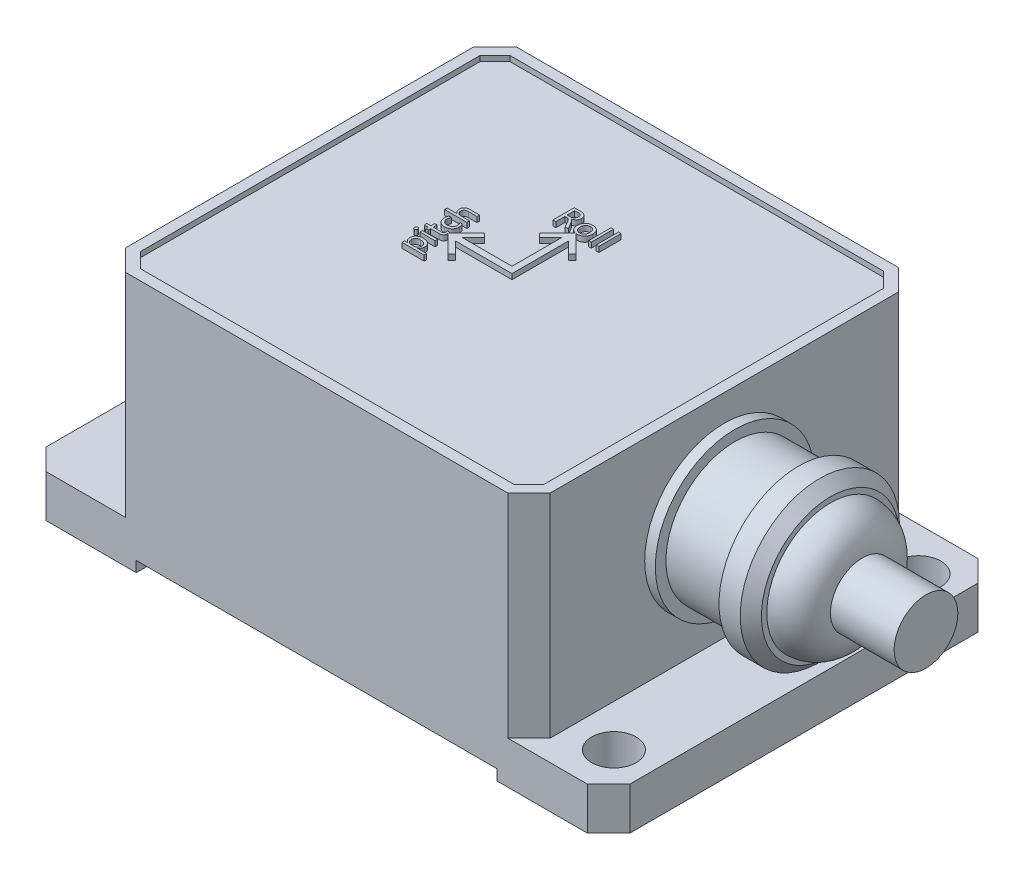
from build123d import *

# Parameters (mm, degrees)
SKETCH_1_W          = 55
SKETCH_1_H          = 36.8
EXTRUDE_1_DEPTH     = 4
SKETCH_2_W          = 40
SKETCH_2_H          = 36.8
EXTRUDE_2_DEPTH     = 20
CHAMFER_1_SIZE      = 2
SKETCH_3_R          = 2.1
CUT_EXTRUDE_1_DEPTH = 20
SKETCH_4_W          = 34
SKETCH_4_H          = 2
CUT_EXTRUDE_2_DEPTH = 52.831361163
CUT_EXTRUDE_3_DEPTH = 0.5
EXTRUDE_3_DEPTH     = 0.5
SKETCH_7_W          = 1.414634147
SKETCH_7_H          = 0.243902439
SKETCH_7_W_2        = 0.243902439
SKETCH_7_H_2        = 2.097560976
EXTRUDE_4_DEPTH     = 0.5
SKETCH_9_R          = 7.5
EXTRUDE_5_DEPTH     = 10
SKETCH_10_R         = 6
EXTRUDE_6_DEPTH     = 3
FILLET_1_R          = 3
SKETCH_11_R         = 3
EXTRUDE_7_DEPTH     = 6
CHAMFER_2_SIZE      = 1
SKETCH_12_R         = 7.5
SKETCH_12_R_2       = 6.5
CUT_EXTRUDE_4_DEPTH = 6


with BuildPart() as part:
    # 草图1 → 凸台-拉伸1 (new body)
    with BuildSketch(Plane(origin=(0, 0, 0), x_dir=(1, 0, 0), z_dir=(0, 1, 0))):
        Rectangle(SKETCH_1_W, SKETCH_1_H)
    extrude(amount=EXTRUDE_1_DEPTH)

    # 草图2 → 凸台-拉伸2 (add)
    with BuildSketch(Plane(origin=(0, 4, 0), x_dir=(1, 0, 0), z_dir=(0, 1, 0))):
        Rectangle(SKETCH_2_W, SKETCH_2_H)
    extrude(amount=EXTRUDE_2_DEPTH)

    # 倒角1
    chamfer_1_edges = [part.edges().sort_by_distance(p)[0] for p in [
        (20, 14, 18.4),
        (20, 14, -18.4),
        (-20, 14, -18.4),
        (-20, 14, 18.4),
        (27.5, 2, 18.4),
        (-27.5, 2, 18.4),
        (-27.5, 2, -18.4),
        (27.5, 2, -18.4),
    ]]
    chamfer(chamfer_1_edges, length=CHAMFER_1_SIZE)

    # 草图3 → 切除-拉伸1 (cut)
    with BuildSketch(Plane(origin=(0, 4, 0), x_dir=(1, 0, 0), z_dir=(0, 1, 0))):
        with Locations(Location((-23.95, 0, 0), (0, 0, 270))):
            Circle(SKETCH_3_R)
        with Locations(Location((23.95, -14.35, 0), (0, 0, 270))):
            Circle(SKETCH_3_R)
        with Locations(Location((23.95, 14.35, 0), (0, 0, 270))):
            Circle(SKETCH_3_R)
    extrude(amount=-CUT_EXTRUDE_1_DEPTH, mode=Mode.SUBTRACT)

    # 草图4 → 切除-拉伸2 (cut, through all)
    with BuildSketch(Plane.XY.offset(18.4)):
        Rectangle(SKETCH_4_W, SKETCH_4_H)
    extrude(amount=-CUT_EXTRUDE_2_DEPTH, mode=Mode.SUBTRACT)

    # 草图5 → 切除-拉伸3 (cut)
    with BuildSketch(Plane(origin=(0, 24, 0), x_dir=(1, 0, 0), z_dir=(0, 1, 0))):
        Polygon((17.585786438, 17.4), (-17.585786438, 17.4), (-19, 15.985786438), (-19, -15.985786438), (-17.585786438, -17.4), (17.585786438, -17.4), (19, -15.985786438), (19, 15.985786438), align=None)
    extrude(amount=-CUT_EXTRUDE_3_DEPTH, mode=Mode.SUBTRACT)

    # 草图6 → 凸台-拉伸3 (add)
    with BuildSketch(Plane(origin=(0, 23.5, 0), x_dir=(1, 0, 0), z_dir=(0, 1, 0))):
        Polygon((-0.3, 0.3), (-5, 0.3), (-3.939339828, 1.360660172), (-4.292893219, 1.714213562), (-6.007106781, 0), (-4.292893219, -1.714213562), (-3.939339828, -1.360660172), (-5, -0.3), (0, -0.3), (0.3, -0.3), (0.3, 0), (0.3, 5), (1.360660172, 3.939339828), (1.714213562, 4.292893219), (0, 6.007106781), (-1.714213562, 4.292893219), (-1.360660172, 3.939339828), (-0.3, 5), align=None)
    extrude(amount=EXTRUDE_3_DEPTH)

    # 草图7 → 凸台-拉伸4 (add)
    # profile 1 of 10: a face of its own
    with BuildSketch(Plane(origin=(0, 23.5, 0), x_dir=(1, 0, 0), z_dir=(0, 1, 0))):
        with BuildLine():
            Line((-6.228143367, -2.682926829), (-5.348570196, -2.682926829))
            Line((-5.348570196, -2.682926829), (-5.348570196, -2.926829268))
            Line((-5.348570196, -2.926829268), (-7.421740928, -2.926829268))
            Line((-7.421740928, -2.926829268), (-7.421740928, -2.682926829))
            Line((-7.421740928, -2.682926829), (-7.15573483, -2.682926829))
            Line((-7.15573483, -2.682926829), (-7.15573483, -2.677591463))
            add(Edge.make_bspline(
                [(-7.15573483, -2.677591463), (-7.178888789, -2.663185346), (-7.223877645, -2.635193816), (-7.282991276, -2.584420625), (-7.333608214, -2.529414433), (-7.374704079, -2.468847266), (-7.407272995, -2.403601095), (-7.429419275, -2.333077041), (-7.443755863, -2.257947748), (-7.445325223, -2.206115517), (-7.446131171, -2.179496951)],
                knots=[0, 0, 0, 0, 1.078187335, 2.094951195, 3.073951912, 4.029433151, 4.983033233, 5.949986131, 6.947210472, 8, 8, 8, 8], degree=3))
            add(Edge.make_bspline(
                [(-7.446131171, -2.179496951), (-7.445559746, -2.156853256), (-7.444447694, -2.112786284), (-7.435391667, -2.048599984), (-7.421200267, -1.988059142), (-7.400406288, -1.931360936), (-7.374108751, -1.878239046), (-7.341262434, -1.829221144), (-7.303146509, -1.783627855), (-7.258990824, -1.742353654), (-7.209822516, -1.705690981), (-7.156810093, -1.673029024), (-7.099503908, -1.645879702), (-7.038166076, -1.623910904), (-6.972970369, -1.606191029), (-6.903652731, -1.594449183), (-6.830596288, -1.586357206), (-6.780504438, -1.585701872), (-6.754820196, -1.585365854)],
                knots=[0, 0, 0, 0, 1.054889125, 2.052923234, 3.01501475, 3.947730946, 4.861176617, 5.770854059, 6.691104601, 7.62511638, 8.580664347, 9.545266383, 10.522431879, 11.530008075, 12.578381207, 13.666585891, 14.803558425, 16, 16, 16, 16], degree=3))
            add(Edge.make_bspline(
                [(-6.754820196, -1.585365854), (-6.72647123, -1.585828166), (-6.671040292, -1.586732128), (-6.589989501, -1.595250163), (-6.513310515, -1.609328583), (-6.440682685, -1.628489492), (-6.372816432, -1.654412876), (-6.308528626, -1.684674664), (-6.249039769, -1.721489785), (-6.194173466, -1.763380316), (-6.144444808, -1.809721524), (-6.101200589, -1.86069206), (-6.064389955, -1.915345678), (-6.034279104, -1.974037927), (-6.011081767, -2.036614658), (-5.994807234, -2.10311658), (-5.984630269, -2.173339903), (-5.983364876, -2.221509034), (-5.982716537, -2.246189024)],
                knots=[0, 0, 0, 0, 1.188216021, 2.323327435, 3.411778528, 4.454337825, 5.467243364, 6.453418599, 7.428937949, 8.393992373, 9.343461741, 10.272914612, 11.190188136, 12.100057099, 13.031932826, 13.981312572, 14.965703029, 16, 16, 16, 16], degree=3))
            add(Edge.make_bspline(
                [(-5.982716537, -2.246189024), (-5.983425332, -2.268847437), (-5.984812613, -2.313195408), (-5.99636245, -2.377734219), (-6.015992244, -2.438002001), (-6.04292316, -2.494548873), (-6.077902437, -2.546839075), (-6.120267337, -2.595405809), (-6.170658569, -2.639559971), (-6.208642376, -2.66468976), (-6.228143367, -2.677591463)],
                knots=[0, 0, 0, 0, 1.044186918, 2.043725318, 3.010571141, 3.958896111, 4.922187342, 5.901827956, 6.922792684, 8, 8, 8, 8], degree=3))
            Line((-6.228143367, -2.677591463), (-6.228143367, -2.682926829))
        make_face()
        with BuildLine():
            add(Edge.make_bspline(
                [(-6.595140318, -2.684070122), (-6.581529734, -2.683692888), (-6.554837207, -2.682953071), (-6.515663144, -2.677456577), (-6.478155189, -2.668684256), (-6.442135632, -2.656624422), (-6.408036113, -2.64034273), (-6.375494397, -2.620819919), (-6.344390236, -2.59781782), (-6.315374856, -2.571305693), (-6.288858793, -2.542290703), (-6.265703665, -2.510953052), (-6.245892255, -2.477968606), (-6.229776866, -2.443090591), (-6.217538285, -2.406509835), (-6.20881556, -2.368216236), (-6.203350226, -2.328027167), (-6.20260736, -2.300576522), (-6.202228732, -2.286585366)],
                knots=[0, 0, 0, 0, 1.046458427, 2.052271993, 3.035679634, 4.0057495, 4.967172194, 5.935568082, 6.920333484, 7.936953682, 8.953573879, 9.938339281, 10.928517117, 11.907645246, 12.886968303, 13.889407684, 14.924264675, 16, 16, 16, 16], degree=3))
            add(Edge.make_bspline(
                [(-6.202228732, -2.286585366), (-6.202633456, -2.270043533), (-6.203421701, -2.237826459), (-6.210573431, -2.190842188), (-6.221679162, -2.146455056), (-6.238342735, -2.105145628), (-6.259078719, -2.066375184), (-6.284722117, -2.030666788), (-6.314763214, -1.997392877), (-6.349573128, -1.967572905), (-6.388053713, -1.940313273), (-6.430574244, -1.91708758), (-6.476690649, -1.89781274), (-6.525894012, -1.881252274), (-6.578835596, -1.868717181), (-6.635313126, -1.860209996), (-6.695262661, -1.854753764), (-6.736388187, -1.854029913), (-6.757487879, -1.853658537)],
                knots=[0, 0, 0, 0, 0.997677617, 1.943089067, 2.86163638, 3.75280666, 4.624068763, 5.509018114, 6.399099569, 7.322942249, 8.269409922, 9.240398368, 10.239988683, 11.28243395, 12.370208899, 13.518437828, 14.726819993, 16, 16, 16, 16], degree=3))
            add(Edge.make_bspline(
                [(-6.757487879, -1.853658537), (-6.775288364, -1.853866247), (-6.810085804, -1.854272291), (-6.860746895, -1.859907296), (-6.90840096, -1.868114352), (-6.953262171, -1.879498736), (-6.994928962, -1.894725324), (-7.03384395, -1.913016938), (-7.069572323, -1.934949611), (-7.102198745, -1.960051253), (-7.131781344, -1.987739901), (-7.156988165, -2.018529881), (-7.178500564, -2.051479538), (-7.196209926, -2.086874883), (-7.20992242, -2.124874112), (-7.219833868, -2.165352203), (-7.225562581, -2.208295523), (-7.226261696, -2.237660705), (-7.226618976, -2.252667683)],
                knots=[0, 0, 0, 0, 1.226032639, 2.396720938, 3.507764523, 4.556614879, 5.581221338, 6.56012207, 7.51496907, 8.463939536, 9.392750702, 10.300617643, 11.198981417, 12.099390027, 13.021535839, 13.976944443, 14.966124265, 16, 16, 16, 16], degree=3))
            add(Edge.make_bspline(
                [(-7.226618976, -2.252667683), (-7.226299991, -2.268060525), (-7.225672568, -2.298337151), (-7.219336407, -2.342605677), (-7.209505023, -2.384736564), (-7.195756906, -2.424795255), (-7.177655324, -2.462637012), (-7.155916462, -2.498571943), (-7.130245736, -2.532434263), (-7.100401698, -2.563367865), (-7.068080074, -2.592021295), (-7.032598398, -2.616252269), (-6.995564212, -2.63776829), (-6.955650261, -2.65415503), (-6.913931865, -2.667779196), (-6.869868918, -2.677167503), (-6.823577374, -2.683039924), (-6.791931922, -2.683722), (-6.775780562, -2.684070122)],
                knots=[0, 0, 0, 0, 1.055142017, 2.075389376, 3.060199554, 4.019076789, 4.973907943, 5.93171582, 6.895370789, 7.881413521, 8.875621505, 9.852071251, 10.823610854, 11.807495604, 12.804943363, 13.830311844, 14.892623976, 16, 16, 16, 16], degree=3))
            Line((-6.775780562, -2.684070122), (-6.595140318, -2.684070122))
        make_face(mode=Mode.SUBTRACT)
    # profile 2 of 10: a face of its own
    with BuildSketch(Plane(origin=(0, 23.5, 0), x_dir=(1, 0, 0), z_dir=(0, 1, 0))):
        with BuildLine():
            add(Edge.make_bspline(
                [(-7.920597635, -1.268292683), (-7.931471537, -1.267895086), (-7.952713513, -1.267118387), (-7.982816768, -1.257653049), (-8.010738931, -1.243988353), (-8.03479701, -1.223963533), (-8.055035972, -1.20020657), (-8.069841896, -1.173132243), (-8.078507231, -1.1431766), (-8.079674897, -1.122389503), (-8.080277513, -1.111661585)],
                knots=[0, 0, 0, 0, 1.043030261, 2.037541102, 3.011077323, 4.019551348, 5.026392696, 6.000466463, 6.968069955, 8, 8, 8, 8], degree=3))
            add(Edge.make_bspline(
                [(-8.080277513, -1.111661585), (-8.079875386, -1.100790351), (-8.079089839, -1.079553586), (-8.069636682, -1.049248209), (-8.055619437, -1.021328966), (-8.035586643, -0.996909335), (-8.011279471, -0.976933988), (-7.983877788, -0.961385746), (-7.952949546, -0.953086601), (-7.931566392, -0.95185254), (-7.920597635, -0.951219512)],
                knots=[0, 0, 0, 0, 1.029888689, 2.011869274, 2.989384935, 3.985152777, 4.988579081, 5.96676578, 6.957027029, 8, 8, 8, 8], degree=3))
            add(Edge.make_bspline(
                [(-7.920597635, -0.951219512), (-7.90975352, -0.951850052), (-7.888615582, -0.953079135), (-7.858082406, -0.961413806), (-7.831054636, -0.976814176), (-7.807481224, -0.997174805), (-7.787489492, -1.021308294), (-7.773360005, -1.049187985), (-7.764512689, -1.079622734), (-7.763647815, -1.100801814), (-7.763204342, -1.111661585)],
                knots=[0, 0, 0, 0, 1.038223291, 2.023761268, 2.998208053, 3.990102717, 4.992895612, 5.97730756, 6.962845537, 8, 8, 8, 8], degree=3))
            add(Edge.make_bspline(
                [(-7.763204342, -1.111661585), (-7.763641333, -1.122521604), (-7.764488639, -1.143578673), (-7.773284345, -1.17367933), (-7.787525424, -1.200908814), (-7.807516127, -1.2242627), (-7.831084595, -1.24394461), (-7.858289438, -1.258312653), (-7.888572951, -1.266954285), (-7.909742666, -1.267839025), (-7.920597635, -1.268292683)],
                knots=[0, 0, 0, 0, 1.047673501, 2.031389945, 3.003999308, 3.99801593, 4.984183625, 5.956792988, 6.952326499, 8, 8, 8, 8], degree=3))
        make_face()
    # profile 3 of 10: a face of its own
    with BuildSketch(Plane(origin=(0, 23.5, 0), x_dir=(1, 0, 0), z_dir=(0, 1, 0))):
        with Locations((-6.714423854, -1.12195122)):
            Rectangle(SKETCH_7_W, SKETCH_7_H)
    # profile 4 of 10: a face of its own
    with BuildSketch(Plane(origin=(0, 23.5, 0), x_dir=(1, 0, 0), z_dir=(0, 1, 0))):
        with BuildLine():
            add(Edge.make_bspline(
                [(-6.037594586, 0.146341463), (-6.029031083, 0.13148125), (-6.011296475, 0.100706456), (-5.994760964, 0.047161362), (-5.984394212, -0.013052134), (-5.983294257, -0.055716675), (-5.982716537, -0.078125)],
                knots=[0, 0, 0, 0, 0.876635898, 1.815471108, 2.852638957, 4, 4, 4, 4], degree=3))
            add(Edge.make_bspline(
                [(-5.982716537, -0.078125), (-5.982953319, -0.09363924), (-5.983414598, -0.123862797), (-5.988593468, -0.167675015), (-5.99623602, -0.208601838), (-6.0079438, -0.246291737), (-6.022207768, -0.281230041), (-6.040307278, -0.31298453), (-6.061331823, -0.341946488), (-6.085934693, -0.367565645), (-6.113743135, -0.390255292), (-6.144576488, -0.410177034), (-6.179039035, -0.426470676), (-6.21632216, -0.440342301), (-6.257165174, -0.450367334), (-6.300950989, -0.458003464), (-6.348091607, -0.462610285), (-6.380571999, -0.463140656), (-6.397350684, -0.463414634)],
                knots=[0, 0, 0, 0, 1.146606007, 2.233722854, 3.257987083, 4.220703627, 5.147033956, 6.043005145, 6.91663835, 7.786982928, 8.661373291, 9.565530169, 10.494001205, 11.474697032, 12.502186621, 13.598637889, 14.759506997, 16, 16, 16, 16], degree=3))
            Line((-6.397350684, -0.463414634), (-7.202228732, -0.463414634))
            Line((-7.202228732, -0.463414634), (-7.202228732, -0.707317073))
            Line((-7.202228732, -0.707317073), (-7.421740928, -0.707317073))
            Line((-7.421740928, -0.707317073), (-7.421740928, -0.463414634))
            Line((-7.421740928, -0.463414634), (-7.757868976, -0.463414634))
            Line((-7.757868976, -0.463414634), (-7.836375074, -0.219512195))
            Line((-7.836375074, -0.219512195), (-7.421740928, -0.219512195))
            Line((-7.421740928, -0.219512195), (-7.421740928, 0.146341463))
            Line((-7.421740928, 0.146341463), (-7.202228732, 0.146341463))
            Line((-7.202228732, 0.146341463), (-7.202228732, -0.219512195))
            Line((-7.202228732, -0.219512195), (-6.453753123, -0.219512195))
            add(Edge.make_bspline(
                [(-6.453753123, -0.219512195), (-6.442950955, -0.219376781), (-6.422082996, -0.219115184), (-6.391925256, -0.216811918), (-6.364034583, -0.213079369), (-6.338544527, -0.207810992), (-6.315332098, -0.201098519), (-6.294817498, -0.192147678), (-6.276306553, -0.182467693), (-6.255127242, -0.16696073), (-6.232878417, -0.141980819), (-6.214595192, -0.103750097), (-6.204198661, -0.057578828), (-6.202916542, -0.024320525), (-6.202228732, -0.006478659)],
                knots=[0, 0, 0, 0, 1.016686329, 1.964065726, 2.845130407, 3.663600224, 4.412652919, 5.114499978, 5.76726369, 6.374757523, 7.5773247, 8.871466733, 10.321655984, 12, 12, 12, 12], degree=3))
            add(Edge.make_bspline(
                [(-6.202228732, -0.006478659), (-6.202849759, 0.007693593), (-6.204069972, 0.035539668), (-6.214891109, 0.075758463), (-6.231880428, 0.113497978), (-6.248643371, 0.135322514), (-6.257106781, 0.146341463)],
                knots=[0, 0, 0, 0, 1.024550126, 2.013067521, 2.996821364, 4, 4, 4, 4], degree=3))
            Line((-6.257106781, 0.146341463), (-6.037594586, 0.146341463))
        make_face()
    # profile 5 of 10: a face of its own
    with BuildSketch(Plane(origin=(0, 23.5, 0), x_dir=(1, 0, 0), z_dir=(0, 1, 0))):
        with BuildLine():
            add(Edge.make_bspline(
                [(-6.104667757, 1.414634146), (-6.094878968, 1.400958274), (-6.075317058, 1.37362842), (-6.050626903, 1.329487671), (-6.029749239, 1.283413899), (-6.012315275, 1.235301447), (-5.999181688, 1.185137353), (-5.989598865, 1.132918169), (-5.983764409, 1.078639273), (-5.983070041, 1.041681225), (-5.982716537, 1.022865854)],
                knots=[0, 0, 0, 0, 0.965865095, 1.930184097, 2.900453022, 3.870282464, 4.8671806, 5.876615486, 6.91898325, 8, 8, 8, 8], degree=3))
            add(Edge.make_bspline(
                [(-5.982716537, 1.022865854), (-5.983273794, 0.997811391), (-5.98436392, 0.948798941), (-5.993715825, 0.877217495), (-6.008856492, 0.809422071), (-6.030190343, 0.745369009), (-6.057974253, 0.685251945), (-6.090938502, 0.62837446), (-6.131182974, 0.575928304), (-6.176662475, 0.527464567), (-6.226777453, 0.48350381), (-6.281404375, 0.445863214), (-6.338965323, 0.412885338), (-6.400910939, 0.387344346), (-6.465816046, 0.366411547), (-6.534556737, 0.352183677), (-6.606841828, 0.34318348), (-6.656342272, 0.342045308), (-6.681649464, 0.341463415)],
                knots=[0, 0, 0, 0, 1.094474989, 2.141051712, 3.148380123, 4.126152372, 5.084957342, 6.037959719, 6.992771127, 7.96673834, 8.938567591, 9.899491397, 10.861392787, 11.831571803, 12.821730032, 13.83752712, 14.894431792, 16, 16, 16, 16], degree=3))
            add(Edge.make_bspline(
                [(-6.681649464, 0.341463415), (-6.709627362, 0.341981331), (-6.764356057, 0.342994447), (-6.844263421, 0.352890088), (-6.920132796, 0.368185477), (-6.991755907, 0.39057956), (-7.059541746, 0.418503792), (-7.122770718, 0.453705695), (-7.182218353, 0.494385331), (-7.236575471, 0.541782818), (-7.285705834, 0.594197504), (-7.328672222, 0.651300618), (-7.365034536, 0.712659567), (-7.395071475, 0.778238786), (-7.417715153, 0.848274977), (-7.434129766, 0.922400009), (-7.44418463, 1.000741112), (-7.445472632, 1.054466743), (-7.446131171, 1.081935976)],
                knots=[0, 0, 0, 0, 1.118554013, 2.188048632, 3.215424436, 4.210219764, 5.184986597, 6.142397142, 7.099376154, 8.06107796, 9.020898817, 9.9679937, 10.913451662, 11.868418779, 12.846939202, 13.851611907, 14.901556437, 16, 16, 16, 16], degree=3))
            add(Edge.make_bspline(
                [(-7.446131171, 1.081935976), (-7.445917033, 1.097821221), (-7.445495095, 1.129121423), (-7.442004984, 1.175175427), (-7.436312002, 1.219578349), (-7.428367094, 1.262222787), (-7.418101945, 1.30309706), (-7.405506335, 1.342054379), (-7.39069141, 1.379287681), (-7.378847371, 1.402898623), (-7.37296044, 1.414634146)],
                knots=[0, 0, 0, 0, 1.108095852, 2.183386038, 3.219962151, 4.229826992, 5.207807638, 6.157885019, 7.084399809, 8, 8, 8, 8], degree=3))
            Line((-7.37296044, 1.414634146), (-7.129058001, 1.414634146))
            add(Edge.make_bspline(
                [(-7.129058001, 1.414634146), (-7.136880349, 1.402301483), (-7.152435972, 1.37777659), (-7.172073457, 1.339170734), (-7.189034791, 1.299755404), (-7.202768198, 1.259226913), (-7.213420439, 1.217686219), (-7.221053921, 1.17514897), (-7.225764466, 1.131585379), (-7.226332148, 1.102145966), (-7.226618976, 1.087271341)],
                knots=[0, 0, 0, 0, 1.010758924, 2.010008175, 2.995221233, 3.979923686, 4.969837589, 5.961937597, 6.970243963, 8, 8, 8, 8], degree=3))
            add(Edge.make_bspline(
                [(-7.226618976, 1.087271341), (-7.226156932, 1.069977059), (-7.225253265, 1.036152891), (-7.218837657, 0.986547101), (-7.207300136, 0.939612094), (-7.191561897, 0.895079715), (-7.171784767, 0.852695405), (-7.146791273, 0.813140092), (-7.117721978, 0.775807416), (-7.084016562, 0.741691204), (-7.047047038, 0.710364294), (-7.006208996, 0.683799488), (-6.962986565, 0.660626579), (-6.916576624, 0.641984205), (-6.867182485, 0.627448188), (-6.814714392, 0.617429213), (-6.759446958, 0.610577401), (-6.721559462, 0.610033569), (-6.702228732, 0.609756098)],
                knots=[0, 0, 0, 0, 1.039780133, 2.033602686, 3.000618516, 3.940342421, 4.869672315, 5.80641158, 6.747624256, 7.709043445, 8.68503681, 9.655274881, 10.632492848, 11.629597287, 12.656760899, 13.723296612, 14.838394132, 16, 16, 16, 16], degree=3))
            add(Edge.make_bspline(
                [(-6.702228732, 0.609756098), (-6.683153158, 0.610050409), (-6.646041485, 0.610622994), (-6.592073404, 0.617125138), (-6.541116121, 0.62631714), (-6.493294408, 0.639948098), (-6.448933667, 0.658140396), (-6.407322347, 0.679382156), (-6.369124338, 0.705020931), (-6.334362487, 0.734542741), (-6.303101927, 0.767081994), (-6.276182351, 0.803027663), (-6.253350704, 0.841501708), (-6.234424568, 0.882711348), (-6.219977519, 0.926712832), (-6.209912368, 0.973476127), (-6.203040171, 1.02279), (-6.20250323, 1.056632025), (-6.202228732, 1.073932927)],
                knots=[0, 0, 0, 0, 1.184991646, 2.305410152, 3.373910071, 4.400970275, 5.389177644, 6.349713865, 7.300104383, 8.241300069, 9.179510456, 10.098554892, 11.02610668, 11.955303629, 12.91157938, 13.898145208, 14.925478513, 16, 16, 16, 16], degree=3))
            add(Edge.make_bspline(
                [(-6.202228732, 1.073932927), (-6.202591794, 1.088940696), (-6.203314411, 1.118811363), (-6.209235084, 1.163193395), (-6.218833814, 1.206901879), (-6.232071209, 1.249929028), (-6.249607765, 1.292236445), (-6.270367865, 1.334028367), (-6.295369949, 1.3751121), (-6.314460496, 1.401300834), (-6.324179952, 1.414634146)],
                knots=[0, 0, 0, 0, 0.977136442, 1.944840573, 2.910420368, 3.889131681, 4.872413256, 5.889906104, 6.925700589, 8, 8, 8, 8], degree=3))
            Line((-6.324179952, 1.414634146), (-6.104667757, 1.414634146))
        make_face()
    # profile 6 of 10: a face of its own
    with BuildSketch(Plane(origin=(0, 23.5, 0), x_dir=(1, 0, 0), z_dir=(0, 1, 0))):
        with BuildLine():
            Line((-6.007106781, 2.951219512), (-6.007106781, 2.707317073))
            Line((-6.007106781, 2.707317073), (-6.806649464, 2.707317073))
            add(Edge.make_bspline(
                [(-6.806649464, 2.707317073), (-6.823551894, 2.707137598), (-6.856386768, 2.706788946), (-6.904125776, 2.70295393), (-6.948535911, 2.696524924), (-6.989754281, 2.687902485), (-7.027539944, 2.676345295), (-7.062332471, 2.662958145), (-7.093606661, 2.646344676), (-7.121509724, 2.627188153), (-7.146589381, 2.605858325), (-7.168161251, 2.581631838), (-7.18602187, 2.554666042), (-7.201182532, 2.525513603), (-7.212400204, 2.493633256), (-7.220909186, 2.459468049), (-7.225888811, 2.422657023), (-7.226370607, 2.397245938), (-7.226618976, 2.384146341)],
                knots=[0, 0, 0, 0, 1.340970476, 2.604986117, 3.796720965, 4.89990832, 5.942632159, 6.929074862, 7.853464607, 8.745352497, 9.610172109, 10.459820349, 11.309707724, 12.170759554, 13.060366105, 13.98448102, 14.960985544, 16, 16, 16, 16], degree=3))
            add(Edge.make_bspline(
                [(-7.226618976, 2.384146341), (-7.226263678, 2.370660047), (-7.225563195, 2.344071368), (-7.219701375, 2.305111798), (-7.210241304, 2.267898078), (-7.196692164, 2.232550649), (-7.179636367, 2.198733032), (-7.157889379, 2.167142399), (-7.133146244, 2.136807382), (-7.104614691, 2.108743083), (-7.073039872, 2.083482844), (-7.039538453, 2.060647047), (-7.003465343, 2.04205005), (-6.965504514, 2.026866053), (-6.925832394, 2.014383336), (-6.884002647, 2.006379586), (-6.840347662, 2.000591909), (-6.810481044, 2.000200199), (-6.795216537, 2)],
                knots=[0, 0, 0, 0, 1.001835929, 1.97515297, 2.920835077, 3.850117241, 4.78322796, 5.728485857, 6.69431096, 7.68900422, 8.696031158, 9.696264434, 10.697032212, 11.705076462, 12.732344971, 13.782141624, 14.866476546, 16, 16, 16, 16], degree=3))
            Line((-6.795216537, 2), (-6.007106781, 2))
            Line((-6.007106781, 2), (-6.007106781, 1.756097561))
            Line((-6.007106781, 1.756097561), (-8.104667757, 1.756097561))
            Line((-8.104667757, 1.756097561), (-8.104667757, 2))
            Line((-8.104667757, 2), (-7.167548854, 2))
            Line((-7.167548854, 2), (-7.167548854, 2.005335366))
            add(Edge.make_bspline(
                [(-7.167548854, 2.005335366), (-7.189602757, 2.019211029), (-7.232514539, 2.046209852), (-7.289795417, 2.093674403), (-7.33787742, 2.146030335), (-7.377638574, 2.202386242), (-7.408499904, 2.263233712), (-7.430162852, 2.328478983), (-7.444073889, 2.397912186), (-7.445435815, 2.445816128), (-7.446131171, 2.47027439)],
                knots=[0, 0, 0, 0, 1.096688599, 2.133901812, 3.122267962, 4.082677085, 5.030271976, 5.984580543, 6.970989516, 8, 8, 8, 8], degree=3))
            add(Edge.make_bspline(
                [(-7.446131171, 2.47027439), (-7.445731682, 2.489734207), (-7.444956157, 2.527511398), (-7.437846848, 2.582195818), (-7.427081453, 2.633220097), (-7.411305076, 2.680490358), (-7.391301832, 2.724166536), (-7.36608734, 2.763737589), (-7.337060788, 2.799907405), (-7.303328491, 2.832210113), (-7.264521599, 2.860009351), (-7.221960805, 2.88494364), (-7.174556284, 2.905509856), (-7.122794296, 2.92208413), (-7.066664993, 2.935608809), (-7.005921026, 2.944260742), (-6.940915984, 2.950265696), (-6.896095492, 2.950894791), (-6.87296044, 2.951219512)],
                knots=[0, 0, 0, 0, 1.090125692, 2.116252578, 3.085398486, 4.008469924, 4.903522829, 5.770645606, 6.631255408, 7.497383878, 8.378855568, 9.300800622, 10.257179332, 11.26807769, 12.343904728, 13.48873347, 14.703756259, 16, 16, 16, 16], degree=3))
            Line((-6.87296044, 2.951219512), (-6.007106781, 2.951219512))
        make_face()
    # profile 7 of 10: a face of its own
    with BuildSketch(Plane(origin=(0, 23.5, 0), x_dir=(1, 0, 0), z_dir=(0, 1, 0))):
        with BuildLine():
            Line((-0.707317073, 6.007106781), (-1, 6.007106781))
            Line((-1, 6.007106781), (-1.324695122, 6.569987879))
            add(Edge.make_bspline(
                [(-1.324695122, 6.569987879), (-1.33262267, 6.583498742), (-1.348005681, 6.609715895), (-1.371468625, 6.64686172), (-1.394491448, 6.680662636), (-1.416849501, 6.711154867), (-1.438880433, 6.738350912), (-1.460762101, 6.761892777), (-1.481417869, 6.782779861), (-1.508940871, 6.804968737), (-1.544705942, 6.827894316), (-1.591863439, 6.846916548), (-1.642839338, 6.858743952), (-1.678160462, 6.860080325), (-1.696265244, 6.860765318)],
                knots=[0, 0, 0, 0, 1.130740819, 2.194145845, 3.170827357, 4.082355974, 4.923051463, 5.695349335, 6.402154369, 7.0409034, 8.244273015, 9.453324277, 10.69463355, 12, 12, 12, 12], degree=3))
            Line((-1.696265244, 6.860765318), (-1.87804878, 6.860765318))
            Line((-1.87804878, 6.860765318), (-1.87804878, 6.007106781))
            Line((-1.87804878, 6.007106781), (-2.146341463, 6.007106781))
            Line((-2.146341463, 6.007106781), (-2.146341463, 8.007106781))
            Line((-2.146341463, 8.007106781), (-1.543064024, 8.007106781))
            add(Edge.make_bspline(
                [(-1.543064024, 8.007106781), (-1.519673918, 8.006665378), (-1.474071397, 8.005804798), (-1.40759981, 7.999191535), (-1.344855608, 7.9887401), (-1.286000768, 7.973608634), (-1.231189703, 7.953665414), (-1.180258315, 7.929599548), (-1.133006276, 7.901478963), (-1.090321963, 7.868431919), (-1.051686043, 7.832063913), (-1.018154007, 7.791611453), (-0.99002715, 7.747589946), (-0.966379165, 7.700326762), (-0.948602527, 7.649445366), (-0.936081356, 7.595127112), (-0.928347055, 7.537435465), (-0.927343583, 7.497731093), (-0.926829268, 7.477381171)],
                knots=[0, 0, 0, 0, 1.218895871, 2.376420411, 3.477962383, 4.53141632, 5.538862009, 6.513239363, 7.463634743, 8.398567947, 9.321158646, 10.2239854, 11.129406106, 12.03842662, 12.972374671, 13.931150821, 14.93964027, 16, 16, 16, 16], degree=3))
            add(Edge.make_bspline(
                [(-0.926829268, 7.477381171), (-0.927041562, 7.460595865), (-0.927459251, 7.427570686), (-0.93312183, 7.379329287), (-0.941289053, 7.333277455), (-0.95321175, 7.289552865), (-0.96841975, 7.24795201), (-0.987002151, 7.208543059), (-1.009503231, 7.171815391), (-1.034553519, 7.136779073), (-1.063734996, 7.104389347), (-1.096256964, 7.074336413), (-1.131734126, 7.046220923), (-1.171155153, 7.021275688), (-1.213234713, 6.997379248), (-1.259279905, 6.976629956), (-1.308497125, 6.957786795), (-1.342911905, 6.947554814), (-1.360518293, 6.942320196)],
                knots=[0, 0, 0, 0, 1.074656955, 2.114393259, 3.107181087, 4.068555706, 5.013394394, 5.941580924, 6.854299593, 7.76908369, 8.696949116, 9.641262007, 10.603359607, 11.592003282, 12.626631854, 13.700826558, 14.823757099, 16, 16, 16, 16], degree=3))
            Line((-1.360518293, 6.942320196), (-1.360518293, 6.935841537))
            add(Edge.make_bspline(
                [(-1.360518293, 6.935841537), (-1.34715667, 6.929649055), (-1.320577104, 6.917330681), (-1.28352925, 6.893849819), (-1.249338815, 6.866574651), (-1.223026717, 6.840424928), (-1.202402266, 6.816818305), (-1.186144535, 6.795919479), (-1.1678805, 6.772858883), (-1.149649529, 6.74592082), (-1.129278142, 6.716868982), (-1.108354603, 6.684608429), (-1.086213954, 6.649566277), (-1.071350643, 6.625018781), (-1.063643293, 6.612289708)],
                knots=[0, 0, 0, 0, 1.184822924, 2.356905208, 3.521464881, 4.700445098, 5.338415513, 6.044500847, 6.832186772, 7.706197801, 8.662360415, 9.68937721, 10.801829505, 12, 12, 12, 12], degree=3))
            Line((-1.063643293, 6.612289708), (-0.707317073, 6.007106781))
        make_face()
        with BuildLine():
            Line((-1.87804878, 7.787594586), (-1.87804878, 7.080277513))
            Line((-1.87804878, 7.080277513), (-1.581935976, 7.080277513))
            add(Edge.make_bspline(
                [(-1.581935976, 7.080277513), (-1.567944846, 7.080518618), (-1.540505466, 7.080991474), (-1.50037643, 7.086227748), (-1.46214382, 7.093947447), (-1.426090611, 7.105581668), (-1.392020616, 7.120100343), (-1.359785331, 7.137557813), (-1.329851814, 7.158799749), (-1.302179081, 7.183100393), (-1.277084153, 7.209996416), (-1.255261452, 7.239220708), (-1.236469837, 7.270155444), (-1.220957674, 7.303154601), (-1.209755311, 7.338481969), (-1.201418333, 7.37558208), (-1.195727099, 7.414707144), (-1.195326902, 7.44153717), (-1.195121951, 7.455277513)],
                knots=[0, 0, 0, 0, 1.107295592, 2.171626293, 3.199536045, 4.192135932, 5.165640131, 6.129060805, 7.089167039, 8.0657848, 9.040950802, 9.996619902, 10.948947584, 11.903080024, 12.876532246, 13.877103319, 14.912810223, 16, 16, 16, 16], degree=3))
            add(Edge.make_bspline(
                [(-1.195121951, 7.455277513), (-1.195394939, 7.467995828), (-1.19592641, 7.492756752), (-1.200632278, 7.528858524), (-1.208129774, 7.562844986), (-1.218831456, 7.594671544), (-1.232610129, 7.624430492), (-1.249879344, 7.651760415), (-1.269765715, 7.677215557), (-1.292845625, 7.700189771), (-1.318794491, 7.720770095), (-1.347655359, 7.738834039), (-1.379235818, 7.754011308), (-1.413792822, 7.766218309), (-1.450843818, 7.776095345), (-1.490888828, 7.78295901), (-1.533596703, 7.7865649), (-1.563001888, 7.787244875), (-1.578125, 7.787594586)],
                knots=[0, 0, 0, 0, 1.058384684, 2.060538898, 3.025220841, 3.951579121, 4.850487263, 5.748399523, 6.636984035, 7.534335625, 8.452630291, 9.388656851, 10.363028537, 11.363227871, 12.435470195, 13.551662397, 14.740817851, 16, 16, 16, 16], degree=3))
            Line((-1.578125, 7.787594586), (-1.87804878, 7.787594586))
        make_face(mode=Mode.SUBTRACT)
    # profile 8 of 10: a face of its own
    with BuildSketch(Plane(origin=(0, 23.5, 0), x_dir=(1, 0, 0), z_dir=(0, 1, 0))):
        with BuildLine():
            add(Edge.make_bspline(
                [(-0.56097561, 6.699179952), (-0.560449853, 6.727282722), (-0.559421311, 6.782260443), (-0.549663308, 6.86232827), (-0.534142365, 6.937842935), (-0.512554121, 7.008831755), (-0.484035886, 7.075114668), (-0.449903668, 7.137247677), (-0.408679246, 7.194312424), (-0.361789224, 7.24655672), (-0.309566722, 7.293510293), (-0.252480946, 7.334365902), (-0.19108919, 7.369494756), (-0.12488664, 7.397572905), (-0.054346036, 7.419271986), (0.020536614, 7.434822071), (0.099843454, 7.444577516), (0.154315506, 7.445605572), (0.182164634, 7.446131171)],
                knots=[0, 0, 0, 0, 1.130891478, 2.212373923, 3.241380589, 4.231321622, 5.19354654, 6.141244045, 7.079317473, 8.020841348, 8.962365223, 9.900438651, 10.841726407, 11.803951325, 12.789006411, 13.808002152, 14.87932938, 16, 16, 16, 16], degree=3))
            add(Edge.make_bspline(
                [(0.182164634, 7.446131171), (0.208616891, 7.445589249), (0.260162932, 7.444533235), (0.335242993, 7.435062839), (0.406094239, 7.420399707), (0.472709496, 7.399691574), (0.53448725, 7.371847164), (0.59197017, 7.338550263), (0.645512634, 7.299611541), (0.693642609, 7.253996636), (0.737406414, 7.203682827), (0.775157161, 7.148245454), (0.806970183, 7.088084192), (0.833317644, 7.023669618), (0.853473834, 6.954412207), (0.867912066, 6.880706499), (0.87619857, 6.802265448), (0.87742148, 6.748488032), (0.87804878, 6.720902513)],
                knots=[0, 0, 0, 0, 1.113756326, 2.170314997, 3.181940078, 4.158355207, 5.102026982, 6.029850454, 6.952351345, 7.883578216, 8.816801288, 9.756231341, 10.70172166, 11.67844461, 12.682442287, 13.734942189, 14.838122004, 16, 16, 16, 16], degree=3))
            add(Edge.make_bspline(
                [(0.87804878, 6.720902513), (0.877478777, 6.693946575), (0.876362226, 6.641143954), (0.867169048, 6.56394379), (0.851566444, 6.490848805), (0.829782971, 6.421782658), (0.801861155, 6.356652759), (0.767881872, 6.295402834), (0.72752609, 6.23815346), (0.681204068, 6.185467685), (0.629752429, 6.137823966), (0.574034382, 6.095905624), (0.513583381, 6.06116501), (0.449117409, 6.032378908), (0.380397529, 6.009944732), (0.30738795, 5.993970359), (0.230317583, 5.984301521), (0.177492917, 5.98325211), (0.150533537, 5.982716537)],
                knots=[0, 0, 0, 0, 1.106974384, 2.168396072, 3.187710748, 4.17289257, 5.138253725, 6.093578844, 7.044691026, 8.009713686, 8.969715493, 9.920412514, 10.867278638, 11.827266264, 12.815648618, 13.830975675, 14.893025616, 16, 16, 16, 16], degree=3))
            add(Edge.make_bspline(
                [(0.150533537, 5.982716537), (0.124213154, 5.983289183), (0.072677526, 5.984410431), (-0.002641335, 5.993556259), (-0.073750788, 6.009314231), (-0.141067332, 6.030511357), (-0.204144913, 6.058477597), (-0.263210002, 6.092535557), (-0.318018512, 6.132814855), (-0.368331291, 6.178970947), (-0.413391578, 6.230197469), (-0.453024678, 6.285569631), (-0.486903401, 6.34479232), (-0.513612905, 6.408450158), (-0.535455949, 6.47552073), (-0.549807489, 6.546766348), (-0.559367805, 6.621684429), (-0.560432036, 6.672979919), (-0.56097561, 6.699179952)],
                knots=[0, 0, 0, 0, 1.109340584, 2.172102268, 3.192069327, 4.176030846, 5.142243327, 6.094750183, 7.04480012, 8.003728309, 8.96744442, 9.91554541, 10.870037285, 11.836887681, 12.8208492, 13.838564487, 14.896010537, 16, 16, 16, 16], degree=3))
        make_face()
        with BuildLine():
            add(Edge.make_bspline(
                [(-0.292682927, 6.707183001), (-0.292324143, 6.68811512), (-0.291624012, 6.650905955), (-0.285981618, 6.596696755), (-0.275981079, 6.545601297), (-0.262314753, 6.497671168), (-0.24523337, 6.452586692), (-0.223802778, 6.410755428), (-0.198053971, 6.372276196), (-0.169211686, 6.336672875), (-0.13674614, 6.304926395), (-0.101165978, 6.277570603), (-0.063287318, 6.25392759), (-0.022407844, 6.235377168), (0.020909986, 6.220308052), (0.067027465, 6.209721201), (0.115819695, 6.203666403), (0.149119341, 6.20271537), (0.166158537, 6.202228732)],
                knots=[0, 0, 0, 0, 1.186433505, 2.31521262, 3.386501185, 4.422409794, 5.413365807, 6.382095459, 7.34021986, 8.289662896, 9.228815267, 10.158571698, 11.077817105, 12.000963171, 12.945952963, 13.927754231, 14.939646379, 16, 16, 16, 16], degree=3))
            add(Edge.make_bspline(
                [(0.166158537, 6.202228732), (0.183713848, 6.202499786), (0.217936637, 6.203028185), (0.267506998, 6.20986282), (0.313950367, 6.219821833), (0.356901827, 6.234560312), (0.397046738, 6.252711985), (0.433602754, 6.275789764), (0.467204715, 6.302561039), (0.496926881, 6.333850712), (0.523868786, 6.368499295), (0.546634592, 6.407526011), (0.566462864, 6.449677605), (0.582587793, 6.495499977), (0.594610577, 6.544939065), (0.603244263, 6.597944274), (0.608656984, 6.654480414), (0.609383062, 6.693323979), (0.609756098, 6.713280562)],
                knots=[0, 0, 0, 0, 1.091675539, 2.128141218, 3.108232562, 4.043223565, 4.948740417, 5.843705042, 6.726470706, 7.61544466, 8.523064122, 9.451784335, 10.420813526, 11.418443159, 12.469161808, 13.582968635, 14.758206449, 16, 16, 16, 16], degree=3))
            add(Edge.make_bspline(
                [(0.609756098, 6.713280562), (0.60938158, 6.733363979), (0.608652499, 6.772460721), (0.603269635, 6.829253557), (0.594622464, 6.88238886), (0.582511363, 6.931923442), (0.566548011, 6.977928674), (0.546639684, 7.020185268), (0.523768206, 7.059257147), (0.496929816, 7.094213739), (0.467322577, 7.125890552), (0.433603326, 7.152693194), (0.396951456, 7.175672691), (0.35700618, 7.194385635), (0.313935122, 7.208992892), (0.267511403, 7.218994419), (0.21793544, 7.225816934), (0.183713442, 7.226347045), (0.166158537, 7.226618976)],
                knots=[0, 0, 0, 0, 1.246690419, 2.426954276, 3.538083164, 4.586275558, 5.588946905, 6.555646248, 7.482133528, 8.393834498, 9.286368649, 10.167011869, 11.05982472, 11.966497605, 12.899240598, 13.876975497, 14.910949189, 16, 16, 16, 16], degree=3))
            add(Edge.make_bspline(
                [(0.166158537, 7.226618976), (0.148859381, 7.226181393), (0.115151659, 7.225328755), (0.066041585, 7.218648329), (0.019593225, 7.20819421), (-0.024022637, 7.192742696), (-0.065136745, 7.173449207), (-0.103040545, 7.149063949), (-0.138330134, 7.120851533), (-0.17030681, 7.08817679), (-0.199456301, 7.052177344), (-0.224027363, 7.012078588), (-0.245783476, 6.969325961), (-0.262554706, 6.922852749), (-0.276555244, 6.873645652), (-0.285822906, 6.821034374), (-0.291678095, 6.765244001), (-0.29234189, 6.726888734), (-0.292682927, 6.707183001)],
                knots=[0, 0, 0, 0, 1.058687113, 2.062871248, 3.028742116, 3.968299712, 4.890116563, 5.802701825, 6.72090305, 7.650266932, 8.596399539, 9.550172127, 10.523993966, 11.527967281, 12.569520306, 13.652549532, 14.793953588, 16, 16, 16, 16], degree=3))
        make_face(mode=Mode.SUBTRACT)
    # profile 9 of 10: a face of its own
    with BuildSketch(Plane(origin=(0, 23.5, 0), x_dir=(1, 0, 0), z_dir=(0, 1, 0))):
        with Locations((1.341463415, 7.055887269)):
            Rectangle(SKETCH_7_W_2, SKETCH_7_H_2)
    # profile 10 of 10: a face of its own
    with BuildSketch(Plane(origin=(0, 23.5, 0), x_dir=(1, 0, 0), z_dir=(0, 1, 0))):
        with Locations((2.048780488, 7.055887269)):
            Rectangle(SKETCH_7_W_2, SKETCH_7_H_2)
    extrude(amount=EXTRUDE_4_DEPTH)

    # 草图9 → 凸台-拉伸5 (add)
    with BuildSketch(Plane(origin=(20, 0, 0), x_dir=(0, 0, -1), z_dir=(1, 0, 0))):
        with Locations(Location((0, 14, 0), (0, 0, 180))):
            Circle(SKETCH_9_R)
    extrude(amount=EXTRUDE_5_DEPTH)

    # 草图10 → 凸台-拉伸6 (add)
    with BuildSketch(Plane(origin=(30, 0, 0), x_dir=(0, 0, -1), z_dir=(1, 0, 0))):
        with Locations((0, 14)):
            Circle(SKETCH_10_R)
    extrude(amount=EXTRUDE_6_DEPTH)

    # 圆角1
    fillet_1_edges = [part.edges().sort_by_distance(p)[0] for p in [
        (33, 14, 6),
    ]]
    fillet(fillet_1_edges, radius=FILLET_1_R - 0.0001)  # a hair under: the kernel refuses the full size

    # 草图11 → 凸台-拉伸7 (add)
    with BuildSketch(Plane(origin=(33, 0, 0), x_dir=(0, 0, -1), z_dir=(1, 0, 0))):
        with Locations((0, 14)):
            Circle(SKETCH_11_R)
    extrude(amount=EXTRUDE_7_DEPTH)

    # 倒角2
    chamfer_2_edges = [part.edges().sort_by_distance(p)[0] for p in [
        (30, 14, -7.5),
    ]]
    chamfer(chamfer_2_edges, length=CHAMFER_2_SIZE)

    # 草图12 → 切除-拉伸4 (cut)
    with BuildSketch(Plane(origin=(21, 0, 0), x_dir=(0, 0, -1), z_dir=(1, 0, 0))):
        with Locations(Location((0, 14, 0), (0, 0, 180))):
            Circle(SKETCH_12_R)
        with Locations((0, 14)):
            Circle(SKETCH_12_R_2, mode=Mode.SUBTRACT)
    extrude(amount=CUT_EXTRUDE_4_DEPTH, mode=Mode.SUBTRACT)


solid = part.part
